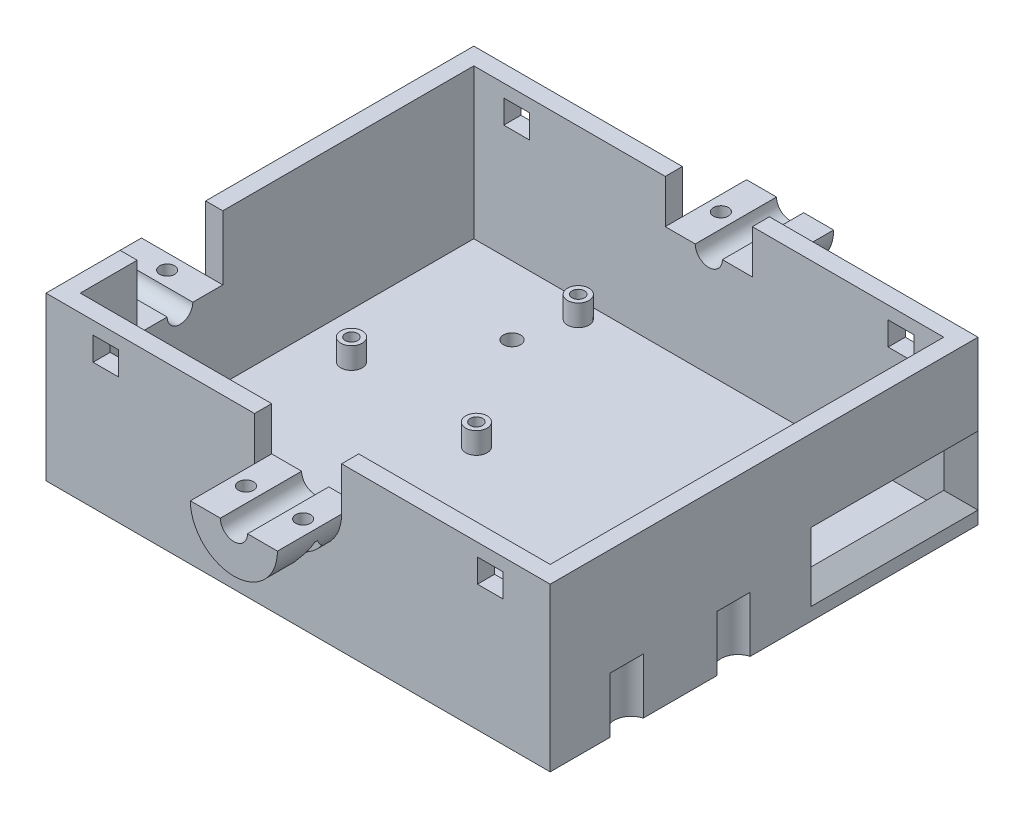
from build123d import *

# Parameters (mm, degrees)
SKETCH1_W                = 117.85
SKETCH1_H                = 100
BOSS_EXTRUDE1_DEPTH      = 3
SKETCH2_R                = 2.5
SKETCH2_R_2              = 1.45
BOSS_EXTRUDE2_DEPTH      = 5
SKETCH3_W                = 117.85
SKETCH3_H                = 100
SKETCH3_W_2              = 109.85
SKETCH3_H_2              = 92
BOSS_EXTRUDE3_DEPTH      = 35
CUT_EXTRUDE1_DEPTH       = 6
SKETCH6_R                = 3.175
BOSS_EXTRUDE4_DEPTH      = 15
CUT_EXTRUDE2_REACH       = 170.99
SKETCH7_R                = 3.175
SKETCH8_R                = 1.75
CUT_EXTRUDE3_DEPTH       = 5
FILLET1_R                = 1
SKETCH9_R                = 1.75
CUT_EXTRUDE4_DEPTH       = 167.996566276
CUT_EXTRUDE5_DEPTH       = 167.52298084
SKETCH11_R               = 2
CUT_EXTRUDE6_DEPTH       = 169.340792807
SKETCH12_R               = 3
BOSS_EXTRUDE7_DEPTH      = 15
CUT_EXTRUDE7_REACH       = 181.772
SKETCH13_R               = 3
SKETCH14_R               = 1.75
CUT_EXTRUDE8_DEPTH       = 167.260706491
CUT_EXTRUDE9_DEPTH       = 15
CUT_EXTRUDE10_START      = -19
SKETCH16_R               = 3.175
CUT_EXTRUDE10_DEPTH      = 19
CUT_EXTRUDE11_DEPTH      = 167.293783708
CUT_EXTRUDE11_DEPTH_BACK = 167.293783708
SKETCH17_W               = 6
SKETCH17_H               = 5.5
SKETCH18_R               = 4
CUT_EXTRUDE12_DEPTH      = 13


with BuildPart() as part:
    # Sketch1 → Boss-Extrude1 (new body)
    with BuildSketch(Plane(origin=(0, 0, 0), x_dir=(1, 0, 0), z_dir=(0, 1, 0))):
        with Locations((58.925, 50)):
            Rectangle(SKETCH1_W, SKETCH1_H)
    extrude(amount=BOSS_EXTRUDE1_DEPTH)

    # Sketch2 → Boss-Extrude2 (add)
    # profile 1 of 5: a face of its own
    with BuildSketch(Plane(origin=(0, 3, 0), x_dir=(1, 0, 0), z_dir=(0, 1, 0))):
        with Locations(Location((32.45, 91.96, 0), (0, 0, 270))):
            Circle(SKETCH2_R)
        with Locations(Location((32.45, 91.96, 0), (0, 0, 270))):
            Circle(SKETCH2_R_2, mode=Mode.SUBTRACT)
    # profile 2 of 5: a face of its own
    with BuildSketch(Plane(origin=(0, 3, 0), x_dir=(1, 0, 0), z_dir=(0, 1, 0))):
        with Locations(Location((94.6, 91.73, 0), (0, 0, 270))):
            Circle(SKETCH2_R)
        with Locations(Location((94.6, 91.73, 0), (0, 0, 270))):
            Circle(SKETCH2_R_2, mode=Mode.SUBTRACT)
    # profile 3 of 5: a face of its own
    with BuildSketch(Plane(origin=(0, 3, 0), x_dir=(1, 0, 0), z_dir=(0, 1, 0))):
        with Locations(Location((14.59, 56.81, 0), (0, 0, 270))):
            Circle(SKETCH2_R)
        with Locations(Location((14.59, 56.81, 0), (0, 0, 270))):
            Circle(SKETCH2_R_2, mode=Mode.SUBTRACT)
    # profile 4 of 5: a face of its own
    with BuildSketch(Plane(origin=(0, 3, 0), x_dir=(1, 0, 0), z_dir=(0, 1, 0))):
        with Locations(Location((46.39, 54.22, 0), (0, 0, 270))):
            Circle(SKETCH2_R)
        with Locations(Location((46.39, 54.22, 0), (0, 0, 270))):
            Circle(SKETCH2_R_2, mode=Mode.SUBTRACT)
    # profile 5 of 5: a face of its own
    with BuildSketch(Plane(origin=(0, 3, 0), x_dir=(1, 0, 0), z_dir=(0, 1, 0))):
        with Locations(Location((110.27, 27.32, 0), (0, 0, 270))):
            Circle(SKETCH2_R)
        with Locations(Location((110.27, 27.32, 0), (0, 0, 270))):
            Circle(SKETCH2_R_2, mode=Mode.SUBTRACT)
    extrude(amount=BOSS_EXTRUDE2_DEPTH)

    # Sketch3 → Boss-Extrude3 (add)
    with BuildSketch(Plane(origin=(0, 3, 0), x_dir=(1, 0, 0), z_dir=(0, 1, 0))):
        with Locations((58.925, 50)):
            Rectangle(SKETCH3_W, SKETCH3_H)
        with Locations((58.925, 50)):
            Rectangle(SKETCH3_W_2, SKETCH3_H_2, mode=Mode.SUBTRACT)
    extrude(amount=BOSS_EXTRUDE3_DEPTH)

    # Sketch4 → Cut-Extrude1 (cut)
    with BuildSketch(Plane(origin=(0, 8, 0), x_dir=(1, 0, 0), z_dir=(0, 1, 0))):
        Polygon((117.85, 100), (113.85, 96), (113.85, 66), (117.85, 66), align=None)
    extrude(amount=CUT_EXTRUDE1_DEPTH, mode=Mode.SUBTRACT)

    # Chamfer1
    # the kernel refuses this chamfer: 5 mm, written as the material it takes off along each edge
    with BuildSketch(Plane(origin=(117.85, 8, -66), x_dir=(0.0274958766105877, -0.9996219169112968, 0), z_dir=(0, 0, -1))) as chamfer1_piece_1_section:
        with BuildLine():
            Line((5.143365976, 0), (-0.282735774, 5.135588968))
            Line((-0.282735774, 5.135588968), (-0.382697966, 5.13283938))
            ThreePointArc((-0.382697966, 5.13283938), (-0.170646135, 2.566989148), (-0.099962192, -0.002749588))
            Line((-0.099962192, -0.002749588), (0.002749588, -0.099962192))
            ThreePointArc((0.002749588, -0.099962192), (2.572488324, -0.029278248), (5.146115564, -0.099962192))
            Line((5.146115564, -0.099962192), (5.143365976, 0))
        make_face()
    chamfer1_piece_1 = extrude(amount=34, mode=Mode.PRIVATE)
    chamfer1_piece_1 = split(chamfer1_piece_1, bisect_by=Plane(origin=(108.149103573, 6.324982491, -90.299103573), z_dir=(0.7071067811865488, 0, 0.7071067811865462)), keep=Keep.TOP, mode=Mode.PRIVATE)
    add(chamfer1_piece_1, mode=Mode.SUBTRACT)
    with BuildSketch(Plane(origin=(117.85, 14, -66), x_dir=(0.0274958766105877, 0.9996219169112968, 0), z_dir=(0, 0, -1))) as chamfer1_piece_2_section:
        with BuildLine():
            Line((5.143365976, 0), (-0.282735774, -5.135588968))
            Line((-0.282735774, -5.135588968), (-0.382697966, -5.13283938))
            ThreePointArc((-0.382697966, -5.13283938), (-0.170646135, -2.566989148), (-0.099962192, 0.002749588))
            Line((-0.099962192, 0.002749588), (0.002749588, 0.099962192))
            ThreePointArc((0.002749588, 0.099962192), (2.572488324, 0.029278248), (5.146115564, 0.099962192))
            Line((5.146115564, 0.099962192), (5.143365976, 0))
        make_face()
    chamfer1_piece_2 = extrude(amount=34, mode=Mode.PRIVATE)
    chamfer1_piece_2 = split(chamfer1_piece_2, bisect_by=Plane(origin=(108.149103573, 15.675017509, -90.299103573), z_dir=(0.7071067811865488, 0, 0.7071067811865462)), keep=Keep.TOP, mode=Mode.PRIVATE)
    add(chamfer1_piece_2, mode=Mode.SUBTRACT)
    with BuildSketch(Plane(origin=(117.85, 8, -66), x_dir=(0.0274958766105877, 0, 0.9996219169112968), z_dir=(0, 1, 0))) as chamfer1_piece_3:
        with BuildLine():
            Line((5.143365976, 0), (-0.282735774, -5.135588968))
            Line((-0.282735774, -5.135588968), (-0.382697966, -5.13283938))
            ThreePointArc((-0.382697966, -5.13283938), (-0.170646135, -2.566989148), (-0.099962192, 0.002749588))
            Line((-0.099962192, 0.002749588), (0.002749588, 0.099962192))
            ThreePointArc((0.002749588, 0.099962192), (2.572488324, 0.029278248), (5.146115564, 0.099962192))
            Line((5.146115564, 0.099962192), (5.143365976, 0))
        make_face()
    extrude(amount=6, mode=Mode.SUBTRACT)
    with BuildSketch(Plane(origin=(117.85, -4.85841494, -66), x_dir=(0.0274958766105877, 0, 0.9996219169112968), z_dir=(0, 1, 0))) as chamfer1_piece_4a_section:
        with BuildLine():
            Line((5.143365976, 0), (-0.282735774, -5.135588968))
            Line((-0.282735774, -5.135588968), (-0.382697966, -5.13283938))
            ThreePointArc((-0.382697966, -5.13283938), (-0.170646135, -2.566989148), (-0.099962192, 0.002749588))
            Line((-0.099962192, 0.002749588), (0.002749588, 0.099962192))
            ThreePointArc((0.002749588, 0.099962192), (2.572488324, 0.029278248), (5.146115564, 0.099962192))
            Line((5.146115564, 0.099962192), (5.143365976, 0))
        make_face()
    chamfer1_piece_4a = extrude(amount=18.85841494, mode=Mode.PRIVATE)
    chamfer1_piece_4a = split(chamfer1_piece_4a, bisect_by=Plane(origin=(116.201031866, 8, -64.351031866), z_dir=(0, -1, 0)), keep=Keep.TOP, mode=Mode.PRIVATE)
    with BuildSketch(Plane(origin=(117.85, 8, -53.14158506), x_dir=(0.0274958766105877, -0.9996219169112968, 0), z_dir=(0, 0, -1))) as chamfer1_piece_4b_section:
        with BuildLine():
            Line((5.143365976, 0), (-0.282735774, 5.135588968))
            Line((-0.282735774, 5.135588968), (-0.382697966, 5.13283938))
            ThreePointArc((-0.382697966, 5.13283938), (-0.170646135, 2.566989148), (-0.099962192, -0.002749588))
            Line((-0.099962192, -0.002749588), (0.002749588, -0.099962192))
            ThreePointArc((0.002749588, -0.099962192), (2.572488324, -0.029278248), (5.146115564, -0.099962192))
            Line((5.146115564, -0.099962192), (5.143365976, 0))
        make_face()
    chamfer1_piece_4b = extrude(amount=46.85841494, mode=Mode.PRIVATE)
    chamfer1_piece_4b = split(chamfer1_piece_4b, bisect_by=Plane(origin=(116.201031866, 6.351031866, -66), z_dir=(0, 0, 1)), keep=Keep.TOP, mode=Mode.PRIVATE)
    chamfer1_piece_4 = chamfer1_piece_4a & chamfer1_piece_4b
    add(chamfer1_piece_4, mode=Mode.SUBTRACT)
    with BuildSketch(Plane(origin=(117.85, 14, -53.14158506), x_dir=(0.0274958766105877, 0.9996219169112968, 0), z_dir=(0, 0, -1))) as chamfer1_piece_5a_section:
        with BuildLine():
            Line((5.143365976, 0), (-0.282735774, -5.135588968))
            Line((-0.282735774, -5.135588968), (-0.382697966, -5.13283938))
            ThreePointArc((-0.382697966, -5.13283938), (-0.170646135, -2.566989148), (-0.099962192, 0.002749588))
            Line((-0.099962192, 0.002749588), (0.002749588, 0.099962192))
            ThreePointArc((0.002749588, 0.099962192), (2.572488324, 0.029278248), (5.146115564, 0.099962192))
            Line((5.146115564, 0.099962192), (5.143365976, 0))
        make_face()
    chamfer1_piece_5a = extrude(amount=46.85841494, mode=Mode.PRIVATE)
    chamfer1_piece_5a = split(chamfer1_piece_5a, bisect_by=Plane(origin=(116.201031866, 15.648968134, -66), z_dir=(0, 0, 1)), keep=Keep.TOP, mode=Mode.PRIVATE)
    with BuildSketch(Plane(origin=(117.85, 8, -66), x_dir=(0.0274958766105877, 0, 0.9996219169112968), z_dir=(0, 1, 0))) as chamfer1_piece_5b_section:
        with BuildLine():
            Line((5.143365976, 0), (-0.282735774, -5.135588968))
            Line((-0.282735774, -5.135588968), (-0.382697966, -5.13283938))
            ThreePointArc((-0.382697966, -5.13283938), (-0.170646135, -2.566989148), (-0.099962192, 0.002749588))
            Line((-0.099962192, 0.002749588), (0.002749588, 0.099962192))
            ThreePointArc((0.002749588, 0.099962192), (2.572488324, 0.029278248), (5.146115564, 0.099962192))
            Line((5.146115564, 0.099962192), (5.143365976, 0))
        make_face()
    chamfer1_piece_5b = extrude(amount=18.85841494, mode=Mode.PRIVATE)
    chamfer1_piece_5b = split(chamfer1_piece_5b, bisect_by=Plane(origin=(116.201031866, 14, -64.351031866), z_dir=(0, 1, 0)), keep=Keep.TOP, mode=Mode.PRIVATE)
    chamfer1_piece_5 = chamfer1_piece_5a & chamfer1_piece_5b
    add(chamfer1_piece_5, mode=Mode.SUBTRACT)

    # Sketch6 → Boss-Extrude4 (add)
    with BuildSketch(Plane(origin=(0, 0, -100), x_dir=(-1, 0, 0), z_dir=(0, 0, -1))):
        with BuildLine():
            Line((-69.1, 27.825), (-69.1, 38))
            Line((-69.1, 38), (-48.75, 38))
            Line((-48.75, 38), (-48.75, 27.825))
            ThreePointArc((-48.75, 27.825), (-58.925, 17.65), (-69.1, 27.825))
        make_face()
        with Locations((-58.925, 27.825)):
            Circle(SKETCH6_R, mode=Mode.SUBTRACT)
    boss_extrude4 = extrude(amount=BOSS_EXTRUDE4_DEPTH)

    # Cut-Extrude2: up to this face of the body (flat: up to its plane)
    cut_extrude2_end = Plane(part.part.faces().sort_by_distance((58.925, 20.5, -96))[0])
    # Sketch7 → Cut-Extrude2 (cut, up to the picked face)
    with BuildSketch(Plane(origin=(0, 0, -115), x_dir=(-1, 0, 0), z_dir=(0, 0, -1)), mode=Mode.PRIVATE) as cut_extrude2_sk1:
        with BuildLine():
            Line((-69.1, 27.825), (-62.1, 27.825))
            ThreePointArc((-62.1, 27.825), (-58.925, 31), (-55.75, 27.825))
            Line((-55.75, 27.825), (-48.75, 27.825))
            Line((-48.75, 27.825), (-48.75, 38))
            Line((-48.75, 38), (-69.1, 38))
            Line((-69.1, 38), (-69.1, 27.825))
        make_face()
    cut_extrude2_tool1 = split(extrude(cut_extrude2_sk1.sketch, amount=-CUT_EXTRUDE2_REACH, mode=Mode.PRIVATE), bisect_by=cut_extrude2_end, keep=Keep.BOTH, mode=Mode.PRIVATE)
    # Sketch7 → Cut-Extrude2 (cut, up to the picked face)
    with BuildSketch(Plane(origin=(0, 0, -115), x_dir=(-1, 0, 0), z_dir=(0, 0, -1)), mode=Mode.PRIVATE) as cut_extrude2_sk2:
        with Locations((-58.925, 27.825)):
            Circle(SKETCH7_R)
    cut_extrude2_tool2 = split(extrude(cut_extrude2_sk2.sketch, amount=-CUT_EXTRUDE2_REACH, mode=Mode.PRIVATE), bisect_by=cut_extrude2_end, keep=Keep.BOTH, mode=Mode.PRIVATE)
    add(cut_extrude2_tool1.solids().sort_by(Axis((58.925, 33.222191, -115), (0, 0, 1)))[0], mode=Mode.SUBTRACT)
    add(cut_extrude2_tool2.solids().sort_by(Axis((58.925, 27.825, -115), (0, 0, 1)))[0], mode=Mode.SUBTRACT)

    # Sketch8 → Cut-Extrude3 (cut)
    with BuildSketch(Plane(origin=(0, 0, -115), x_dir=(-1, 0, 0), z_dir=(0, 0, -1))):
        with Locations((-58.925, 21.15)):
            Circle(SKETCH8_R)
    extrude(amount=-CUT_EXTRUDE3_DEPTH, mode=Mode.SUBTRACT)

    # Fillet1
    fillet1_edges = [part.edges().sort_by_distance(p)[0] for p in [
        (60.675, 21.15, -115),
    ]]
    fillet(fillet1_edges, radius=FILLET1_R)

    # Sketch9 → Cut-Extrude4 (cut, through all)
    with BuildSketch(Plane(origin=(0, 27.825, 0), x_dir=(1, 0, 0), z_dir=(0, 1, 0))):
        with Locations(Location((52.25, 105.5, 0), (0, 0, 270))):
            Circle(SKETCH9_R)
        with Locations(Location((65.6, 105.5, 0), (0, 0, 270))):
            Circle(SKETCH9_R)
    cut_extrude4 = extrude(amount=-CUT_EXTRUDE4_DEPTH, mode=Mode.SUBTRACT)

    # Sketch10 → Cut-Extrude5 (cut, through all)
    with BuildSketch(Plane(origin=(0, 24.825, 0), x_dir=(1, 0, 0), z_dir=(0, 1, 0))):
        Polygon((55.483161507, 105.5), (53.866580754, 108.3), (50.633419246, 108.3), (49.016838493, 105.5), (50.633419246, 102.7), (53.866580754, 102.7), align=None)
        Polygon((68.833161507, 105.5), (67.216580754, 108.3), (63.983419246, 108.3), (62.366838493, 105.5), (63.983419246, 102.7), (67.216580754, 102.7), align=None)
    cut_extrude5 = extrude(amount=-CUT_EXTRUDE5_DEPTH, mode=Mode.SUBTRACT)

    # Sketch11 → Cut-Extrude6 (cut, through all)
    with BuildSketch(Plane(origin=(0, 3, 0), x_dir=(1, 0, 0), z_dir=(0, 1, 0))):
        with Locations(Location((28.925, 80, 0), (0, 0, 270))):
            Circle(SKETCH11_R)
        with Locations(Location((88.925, 80, 0), (0, 0, 270))):
            Circle(SKETCH11_R)
        with Locations(Location((28.925, 20, 0), (0, 0, 270))):
            Circle(SKETCH11_R)
        with Locations(Location((88.925, 20, 0), (0, 0, 270))):
            Circle(SKETCH11_R)
    extrude(amount=-CUT_EXTRUDE6_DEPTH, mode=Mode.SUBTRACT)

    # Sketch12 → Boss-Extrude7 (add)
    with BuildSketch(Plane.ZY):
        with BuildLine():
            Line((-37.32, 38), (-37.32, 23))
            ThreePointArc((-37.32, 23), (-27.32, 13), (-17.32, 23))
            Line((-17.32, 23), (-17.32, 38))
            Line((-17.32, 38), (-37.32, 38))
        make_face()
        with Locations((-27.32, 23)):
            Circle(SKETCH12_R, mode=Mode.SUBTRACT)
    extrude(amount=BOSS_EXTRUDE7_DEPTH)

    # Cut-Extrude7: up to this face of the body (flat: up to its plane)
    cut_extrude7_end = Plane(part.part.faces().sort_by_distance((4, 20.5, -50))[0])
    # Sketch13 → Cut-Extrude7 (cut, up to the picked face)
    with BuildSketch(Plane.ZY.offset(15), mode=Mode.PRIVATE) as cut_extrude7_sk1:
        with BuildLine():
            Line((-37.32, 23), (-30.32, 23))
            ThreePointArc((-30.32, 23), (-27.32, 26), (-24.32, 23))
            Line((-24.32, 23), (-17.32, 23))
            Line((-17.32, 23), (-17.32, 38))
            Line((-17.32, 38), (-37.32, 38))
            Line((-37.32, 38), (-37.32, 23))
        make_face()
    cut_extrude7_tool1 = split(extrude(cut_extrude7_sk1.sketch, amount=-CUT_EXTRUDE7_REACH, mode=Mode.PRIVATE), bisect_by=cut_extrude7_end, keep=Keep.BOTH, mode=Mode.PRIVATE)
    # Sketch13 → Cut-Extrude7 (cut, up to the picked face)
    with BuildSketch(Plane.ZY.offset(15), mode=Mode.PRIVATE) as cut_extrude7_sk2:
        with Locations((-27.32, 23)):
            Circle(SKETCH13_R)
    cut_extrude7_tool2 = split(extrude(cut_extrude7_sk2.sketch, amount=-CUT_EXTRUDE7_REACH, mode=Mode.PRIVATE), bisect_by=cut_extrude7_end, keep=Keep.BOTH, mode=Mode.PRIVATE)
    add(cut_extrude7_tool1.solids().sort_by(Axis((-15, 30.807941, -27.32), (1, 0, 0)))[0], mode=Mode.SUBTRACT)
    add(cut_extrude7_tool2.solids().sort_by(Axis((-15, 23, -27.32), (1, 0, 0)))[0], mode=Mode.SUBTRACT)

    # Sketch14 → Cut-Extrude8 (cut, through all)
    with BuildSketch(Plane(origin=(0, 23, 0), x_dir=(1, 0, 0), z_dir=(0, 1, 0))):
        with Locations(Location((-5.5, 33.82, 0), (0, 0, 270))):
            Circle(SKETCH14_R)
        with Locations(Location((-5.5, 20.82, 0), (0, 0, 270))):
            Circle(SKETCH14_R)
    extrude(amount=-CUT_EXTRUDE8_DEPTH, mode=Mode.SUBTRACT)

    # Sketch15 → Cut-Extrude9 (cut)
    with BuildSketch(Plane(origin=(0, 20, 0), x_dir=(1, 0, 0), z_dir=(0, 1, 0))):
        Polygon((-2.7, 32.203419246), (-2.7, 35.436580754), (-5.5, 37.053161507), (-8.3, 35.436580754), (-8.3, 32.203419246), (-5.5, 30.586838493), align=None)
        Polygon((-5.5, 24.053161507), (-8.3, 22.436580754), (-8.3, 19.203419246), (-5.5, 17.586838493), (-2.7, 19.203419246), (-2.7, 22.436580754), align=None)
    extrude(amount=-CUT_EXTRUDE9_DEPTH, mode=Mode.SUBTRACT)

    # Mirror1: Boss-Extrude4, Cut-Extrude4, Cut-Extrude5 across plane
    add(boss_extrude4.mirror(Plane.XY.offset(-50)))
    add(cut_extrude4.mirror(Plane.XY.offset(-50)), mode=Mode.SUBTRACT)
    add(cut_extrude5.mirror(Plane.XY.offset(-50)), mode=Mode.SUBTRACT)

    # Sketch16 → Cut-Extrude10 (cut)
    with BuildSketch(Plane.XY.offset(15).offset(CUT_EXTRUDE10_START)):
        with BuildLine():
            Line((48.75, 27.825), (55.75, 27.825))
            ThreePointArc((55.75, 27.825), (58.925, 31), (62.1, 27.825))
            Line((62.1, 27.825), (69.1, 27.825))
            Line((69.1, 27.825), (69.1, 38))
            Line((69.1, 38), (48.75, 38))
            Line((48.75, 38), (48.75, 27.825))
        make_face()
        with Locations((58.925, 27.825)):
            Circle(SKETCH16_R)
    extrude(amount=CUT_EXTRUDE10_DEPTH, mode=Mode.SUBTRACT)

    # Sketch17 → Cut-Extrude11 (cut, two sides: drawn at the far end of the back side and taken through both)
    with BuildSketch(Plane.XY.offset(-96).offset(-CUT_EXTRUDE11_DEPTH_BACK)):
        with Locations((14, 32.25)):
            Rectangle(SKETCH17_W, SKETCH17_H)
        with Locations((103.85, 32.25)):
            Rectangle(SKETCH17_W, SKETCH17_H)
    extrude(amount=CUT_EXTRUDE11_DEPTH + CUT_EXTRUDE11_DEPTH_BACK, mode=Mode.SUBTRACT)

    # Sketch18 → Cut-Extrude12 (cut)
    with BuildSketch(Plane.XZ):
        with Locations((118.885, -42.895361561)):
            Circle(SKETCH18_R)
        with Locations((118.885, -17.895361561)):
            Circle(SKETCH18_R)
    extrude(amount=-CUT_EXTRUDE12_DEPTH, mode=Mode.SUBTRACT)


solid = part.part
